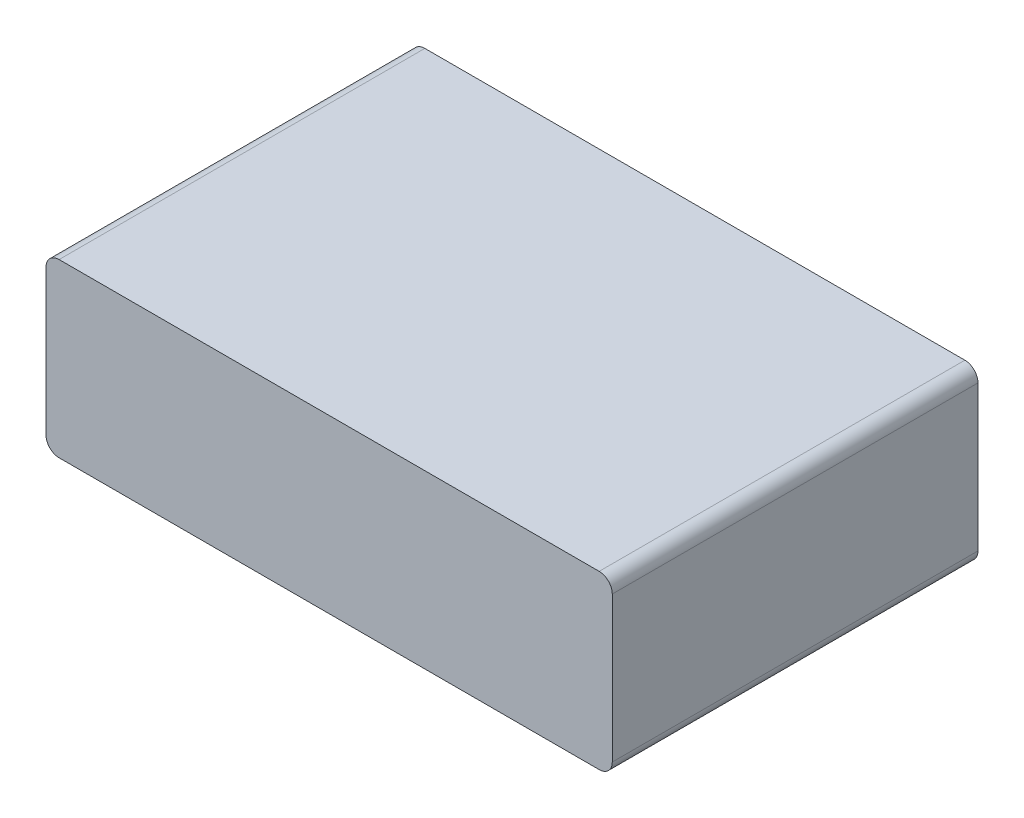
from build123d import *

# Parameters (mm, degrees)
ESQUISSE1_W        = 432
ESQUISSE1_H        = 279
BOSS_EXTRU_1_DEPTH = 131
CONG_1_R           = 10
COQUE1_START       = -206
COQUE1_OUTLINE_W   = 111
COQUE1_OUTLINE_H   = 259
COQUE1_DEPTH       = 412


# Read off the part's stored shape, not the designer's step: Coque1
with BuildPart() as part:
    # Esquisse1 → Boss.-Extru.1 (new body)
    with BuildSketch(Plane(origin=(0, 0, 0), x_dir=(1, 0, 0), z_dir=(0, 1, 0))):
        Rectangle(ESQUISSE1_W, ESQUISSE1_H)
    extrude(amount=BOSS_EXTRU_1_DEPTH)

    # Congé1
    cong_1_edges = [part.edges().sort_by_distance(p)[0] for p in [
        (-216, 131, 0),
        (216, 131, 0),
        (-216, 0, 0),
        (216, 0, 0),
    ]]
    fillet(cong_1_edges, radius=CONG_1_R)

    # Coque1 outline → Coque1 (cut)
    with BuildSketch(Plane.YZ.offset(COQUE1_START)):
        with Locations((65.5, 0)):
            Rectangle(COQUE1_OUTLINE_W, COQUE1_OUTLINE_H)
    extrude(amount=COQUE1_DEPTH, mode=Mode.SUBTRACT)


solid = part.part
